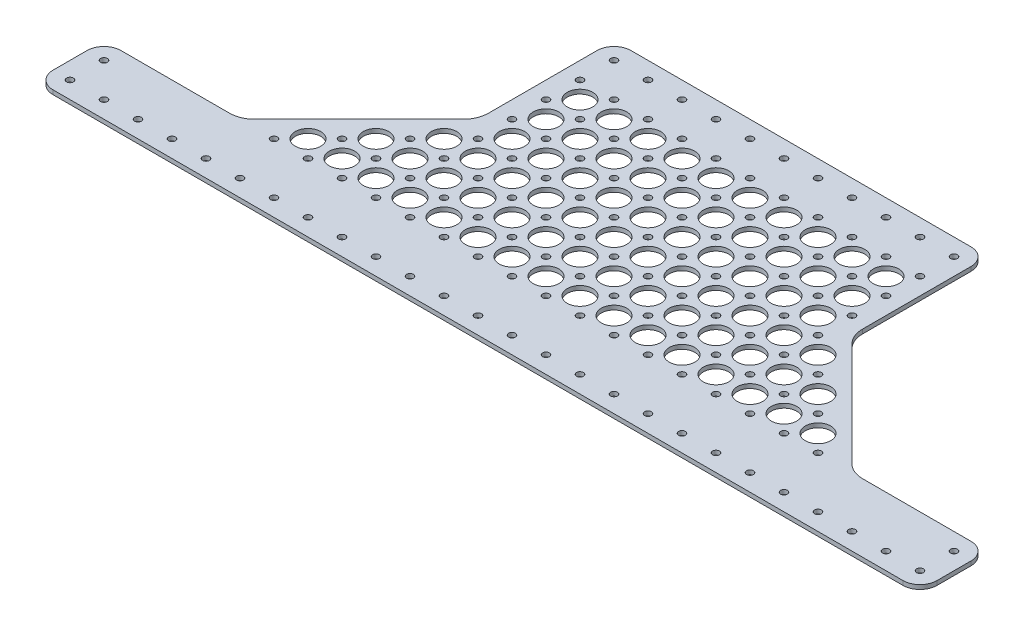
from build123d import *

# Parameters (mm, degrees)
SKETCH1_R           = 2.54
BOSS_EXTRUDE1_DEPTH = 3.175
SKETCH2_W           = 711.2
SKETCH2_H           = 25.4
CUT_EXTRUDE2_DEPTH  = 469.9
CUT_EXTRUDE3_START  = -3.175
SKETCH3_R           = 2.54
SKETCH3_R_2         = 9.525
CUT_EXTRUDE3_DEPTH  = 3.175
FILLET1_R           = 12.7
FILLET2_R           = 19.05


with BuildPart() as part:
    # Sketch1 → Boss-Extrude1 (new body)
    with BuildSketch(Plane(origin=(0, 0, 0), x_dir=(1, 0, 0), z_dir=(0, 1, 0))):
        Polygon((0, 101.6), (0, 0), (-88.904535599, -88.904535599), (-177.804535599, -88.904535599), (-190.504535599, -88.904535599), (-190.504535599, -419.104535599), (-177.804535599, -419.104535599), (-88.904535599, -419.104535599), (0, -508.009071197), (0, -609.609071197), (279.4, -609.609071197), (279.4, -508.009071197), (368.304535599, -419.104535599), (469.904535599, -419.104535599), (469.904535599, -88.904535599), (368.304535599, -88.904535599), (279.4, 0), (279.4, 101.6), align=None)
        with Locations((12.7, -596.909071197)):
            Circle(SKETCH1_R, mode=Mode.SUBTRACT)
        with Locations((38.1, -596.909071197)):
            Circle(SKETCH1_R, mode=Mode.SUBTRACT)
        with Locations((63.5, -596.909071197)):
            Circle(SKETCH1_R, mode=Mode.SUBTRACT)
        with Locations((88.9, -596.909071197)):
            Circle(SKETCH1_R, mode=Mode.SUBTRACT)
        with Locations((114.3, -596.909071197)):
            Circle(SKETCH1_R, mode=Mode.SUBTRACT)
        with Locations((139.7, -596.909071197)):
            Circle(SKETCH1_R, mode=Mode.SUBTRACT)
        with Locations((-177.804535599, -406.404535599)):
            Circle(SKETCH1_R, mode=Mode.SUBTRACT)
        with Locations((-152.404535599, -406.404535599)):
            Circle(SKETCH1_R, mode=Mode.SUBTRACT)
        with Locations((-127.004535599, -406.404535599)):
            Circle(SKETCH1_R, mode=Mode.SUBTRACT)
        with Locations((-177.804535599, -381.004535599)):
            Circle(SKETCH1_R, mode=Mode.SUBTRACT)
        with Locations((-152.404535599, -381.004535599)):
            Circle(SKETCH1_R, mode=Mode.SUBTRACT)
        with Locations((-177.804535599, -355.604535599)):
            Circle(SKETCH1_R, mode=Mode.SUBTRACT)
        with Locations((-127.004535599, -381.004535599)):
            Circle(SKETCH1_R, mode=Mode.SUBTRACT)
        with Locations((-101.604535599, -406.404535599)):
            Circle(SKETCH1_R, mode=Mode.SUBTRACT)
        with Locations((-101.604535599, -381.004535599)):
            Circle(SKETCH1_R, mode=Mode.SUBTRACT)
        with Locations((-177.804535599, -330.204535599)):
            Circle(SKETCH1_R, mode=Mode.SUBTRACT)
        with Locations((-177.804535599, -304.804535599)):
            Circle(SKETCH1_R, mode=Mode.SUBTRACT)
        with Locations((-177.804535599, -279.404535599)):
            Circle(SKETCH1_R, mode=Mode.SUBTRACT)
        with Locations((165.1, -596.909071197)):
            Circle(SKETCH1_R, mode=Mode.SUBTRACT)
        with Locations((190.5, -596.909071197)):
            Circle(SKETCH1_R, mode=Mode.SUBTRACT)
        with Locations((215.9, -596.909071197)):
            Circle(SKETCH1_R, mode=Mode.SUBTRACT)
        with Locations((241.3, -596.909071197)):
            Circle(SKETCH1_R, mode=Mode.SUBTRACT)
        with Locations((266.7, -596.909071197)):
            Circle(SKETCH1_R, mode=Mode.SUBTRACT)
        with Locations((381.004535599, -406.404535599)):
            Circle(SKETCH1_R, mode=Mode.SUBTRACT)
        with Locations((381.004535599, -381.004535599)):
            Circle(SKETCH1_R, mode=Mode.SUBTRACT)
        with Locations((406.404535599, -406.404535599)):
            Circle(SKETCH1_R, mode=Mode.SUBTRACT)
        with Locations((431.804535599, -406.404535599)):
            Circle(SKETCH1_R, mode=Mode.SUBTRACT)
        with Locations((457.204535599, -406.404535599)):
            Circle(SKETCH1_R, mode=Mode.SUBTRACT)
        with Locations((406.404535599, -381.004535599)):
            Circle(SKETCH1_R, mode=Mode.SUBTRACT)
        with Locations((431.804535599, -381.004535599)):
            Circle(SKETCH1_R, mode=Mode.SUBTRACT)
        with Locations((457.204535599, -381.004535599)):
            Circle(SKETCH1_R, mode=Mode.SUBTRACT)
        with Locations((457.204535599, -355.604535599)):
            Circle(SKETCH1_R, mode=Mode.SUBTRACT)
        with Locations((457.204535599, -330.204535599)):
            Circle(SKETCH1_R, mode=Mode.SUBTRACT)
        with Locations((457.204535599, -304.804535599)):
            Circle(SKETCH1_R, mode=Mode.SUBTRACT)
        with Locations((457.204535599, -279.404535599)):
            Circle(SKETCH1_R, mode=Mode.SUBTRACT)
        with Locations((-177.804535599, -254.004535599)):
            Circle(SKETCH1_R, mode=Mode.SUBTRACT)
        with Locations((-177.804535599, -228.604535599)):
            Circle(SKETCH1_R, mode=Mode.SUBTRACT)
        with Locations((-177.804535599, -203.204535599)):
            Circle(SKETCH1_R, mode=Mode.SUBTRACT)
        with Locations((-177.804535599, -177.804535599)):
            Circle(SKETCH1_R, mode=Mode.SUBTRACT)
        with Locations((-177.804535599, -152.404535599)):
            Circle(SKETCH1_R, mode=Mode.SUBTRACT)
        with Locations((-152.404535599, -152.404535599)):
            Circle(SKETCH1_R, mode=Mode.SUBTRACT)
        with Locations((-177.804535599, -127.004535599)):
            Circle(SKETCH1_R, mode=Mode.SUBTRACT)
        with Locations((-152.404535599, -127.004535599)):
            Circle(SKETCH1_R, mode=Mode.SUBTRACT)
        with Locations((-127.004535599, -152.404535599)):
            Circle(SKETCH1_R, mode=Mode.SUBTRACT)
        with Locations((-127.004535599, -127.004535599)):
            Circle(SKETCH1_R, mode=Mode.SUBTRACT)
        with Locations((-177.804535599, -101.604535599)):
            Circle(SKETCH1_R, mode=Mode.SUBTRACT)
        with Locations((-101.604535599, -152.404535599)):
            Circle(SKETCH1_R, mode=Mode.SUBTRACT)
        with Locations((-76.204535599, -152.404535599)):
            Circle(SKETCH1_R, mode=Mode.SUBTRACT)
        with Locations((-101.604535599, -127.004535599)):
            Circle(SKETCH1_R, mode=Mode.SUBTRACT)
        with Locations((-76.204535599, -127.004535599)):
            Circle(SKETCH1_R, mode=Mode.SUBTRACT)
        with Locations((-50.804535599, -152.404535599)):
            Circle(SKETCH1_R, mode=Mode.SUBTRACT)
        with Locations((-25.404535599, -152.404535599)):
            Circle(SKETCH1_R, mode=Mode.SUBTRACT)
        with Locations((-50.804535599, -127.004535599)):
            Circle(SKETCH1_R, mode=Mode.SUBTRACT)
        with Locations((-25.404535599, -127.004535599)):
            Circle(SKETCH1_R, mode=Mode.SUBTRACT)
        with Locations((-0.004535599, -152.404535599)):
            Circle(SKETCH1_R, mode=Mode.SUBTRACT)
        with Locations((-0.004535599, -127.004535599)):
            Circle(SKETCH1_R, mode=Mode.SUBTRACT)
        with Locations((25.395464401, -152.404535599)):
            Circle(SKETCH1_R, mode=Mode.SUBTRACT)
        with Locations((50.795464401, -152.404535599)):
            Circle(SKETCH1_R, mode=Mode.SUBTRACT)
        with Locations((25.395464401, -127.004535599)):
            Circle(SKETCH1_R, mode=Mode.SUBTRACT)
        with Locations((50.795464401, -127.004535599)):
            Circle(SKETCH1_R, mode=Mode.SUBTRACT)
        with Locations((76.195464401, -152.404535599)):
            Circle(SKETCH1_R, mode=Mode.SUBTRACT)
        with Locations((76.195464401, -127.004535599)):
            Circle(SKETCH1_R, mode=Mode.SUBTRACT)
        with Locations((101.595464401, -152.404535599)):
            Circle(SKETCH1_R, mode=Mode.SUBTRACT)
        with Locations((126.995464401, -152.404535599)):
            Circle(SKETCH1_R, mode=Mode.SUBTRACT)
        with Locations((101.595464401, -127.004535599)):
            Circle(SKETCH1_R, mode=Mode.SUBTRACT)
        with Locations((126.995464401, -127.004535599)):
            Circle(SKETCH1_R, mode=Mode.SUBTRACT)
        with Locations((12.7, 88.9)):
            Circle(SKETCH1_R, mode=Mode.SUBTRACT)
        with Locations((38.1, 88.9)):
            Circle(SKETCH1_R, mode=Mode.SUBTRACT)
        with Locations((63.5, 88.9)):
            Circle(SKETCH1_R, mode=Mode.SUBTRACT)
        with Locations((88.9, 88.9)):
            Circle(SKETCH1_R, mode=Mode.SUBTRACT)
        with Locations((114.3, 88.9)):
            Circle(SKETCH1_R, mode=Mode.SUBTRACT)
        with Locations((139.7, 88.9)):
            Circle(SKETCH1_R, mode=Mode.SUBTRACT)
        with Locations((152.395464401, -152.404535599)):
            Circle(SKETCH1_R, mode=Mode.SUBTRACT)
        with Locations((177.795464401, -152.404535599)):
            Circle(SKETCH1_R, mode=Mode.SUBTRACT)
        with Locations((152.395464401, -127.004535599)):
            Circle(SKETCH1_R, mode=Mode.SUBTRACT)
        with Locations((177.795464401, -127.004535599)):
            Circle(SKETCH1_R, mode=Mode.SUBTRACT)
        with Locations((203.195464401, -152.404535599)):
            Circle(SKETCH1_R, mode=Mode.SUBTRACT)
        with Locations((203.195464401, -127.004535599)):
            Circle(SKETCH1_R, mode=Mode.SUBTRACT)
        with Locations((228.595464401, -152.404535599)):
            Circle(SKETCH1_R, mode=Mode.SUBTRACT)
        with Locations((253.995464401, -152.404535599)):
            Circle(SKETCH1_R, mode=Mode.SUBTRACT)
        with Locations((228.595464401, -127.004535599)):
            Circle(SKETCH1_R, mode=Mode.SUBTRACT)
        with Locations((253.995464401, -127.004535599)):
            Circle(SKETCH1_R, mode=Mode.SUBTRACT)
        with Locations((279.395464401, -152.404535599)):
            Circle(SKETCH1_R, mode=Mode.SUBTRACT)
        with Locations((304.795464401, -152.404535599)):
            Circle(SKETCH1_R, mode=Mode.SUBTRACT)
        with Locations((279.395464401, -127.004535599)):
            Circle(SKETCH1_R, mode=Mode.SUBTRACT)
        with Locations((304.795464401, -127.004535599)):
            Circle(SKETCH1_R, mode=Mode.SUBTRACT)
        with Locations((457.204535599, -254.004535599)):
            Circle(SKETCH1_R, mode=Mode.SUBTRACT)
        with Locations((457.204535599, -228.604535599)):
            Circle(SKETCH1_R, mode=Mode.SUBTRACT)
        with Locations((457.204535599, -203.204535599)):
            Circle(SKETCH1_R, mode=Mode.SUBTRACT)
        with Locations((457.204535599, -177.804535599)):
            Circle(SKETCH1_R, mode=Mode.SUBTRACT)
        with Locations((330.195464401, -152.404535599)):
            Circle(SKETCH1_R, mode=Mode.SUBTRACT)
        with Locations((330.195464401, -127.004535599)):
            Circle(SKETCH1_R, mode=Mode.SUBTRACT)
        with Locations((355.595464401, -152.404535599)):
            Circle(SKETCH1_R, mode=Mode.SUBTRACT)
        with Locations((380.995464401, -152.404535599)):
            Circle(SKETCH1_R, mode=Mode.SUBTRACT)
        with Locations((355.595464401, -127.004535599)):
            Circle(SKETCH1_R, mode=Mode.SUBTRACT)
        with Locations((380.995464401, -127.004535599)):
            Circle(SKETCH1_R, mode=Mode.SUBTRACT)
        with Locations((406.395464401, -152.404535599)):
            Circle(SKETCH1_R, mode=Mode.SUBTRACT)
        with Locations((406.395464401, -127.004535599)):
            Circle(SKETCH1_R, mode=Mode.SUBTRACT)
        with Locations((431.795464401, -152.404535599)):
            Circle(SKETCH1_R, mode=Mode.SUBTRACT)
        with Locations((457.204535599, -152.404535599)):
            Circle(SKETCH1_R, mode=Mode.SUBTRACT)
        with Locations((431.795464401, -127.004535599)):
            Circle(SKETCH1_R, mode=Mode.SUBTRACT)
        with Locations((457.204535599, -127.004535599)):
            Circle(SKETCH1_R, mode=Mode.SUBTRACT)
        with Locations((457.204535599, -101.604535599)):
            Circle(SKETCH1_R, mode=Mode.SUBTRACT)
        with Locations((165.1, 88.9)):
            Circle(SKETCH1_R, mode=Mode.SUBTRACT)
        with Locations((190.5, 88.9)):
            Circle(SKETCH1_R, mode=Mode.SUBTRACT)
        with Locations((215.9, 88.9)):
            Circle(SKETCH1_R, mode=Mode.SUBTRACT)
        with Locations((241.3, 88.9)):
            Circle(SKETCH1_R, mode=Mode.SUBTRACT)
        with Locations((266.7, 88.9)):
            Circle(SKETCH1_R, mode=Mode.SUBTRACT)
    extrude(amount=BOSS_EXTRUDE1_DEPTH)

    # Sketch2 → Cut-Extrude2 (cut)
    with BuildSketch(Plane.XY.offset(609.609071197)):
        with Locations((152.586714342, 0)):
            Rectangle(SKETCH2_W, SKETCH2_H)
    extrude(amount=-CUT_EXTRUDE2_DEPTH, mode=Mode.SUBTRACT)

    # Sketch3 → Cut-Extrude3 (cut)
    with BuildSketch(Plane(origin=(0, 3.175, 0), x_dir=(1, 0, 0), z_dir=(0, 1, 0)).offset(CUT_EXTRUDE3_START)):
        with Locations((12.7, 88.9)):
            Circle(SKETCH3_R)
        with Locations((38.1, 88.9)):
            Circle(SKETCH3_R)
        with Locations((63.5, 88.9)):
            Circle(SKETCH3_R)
        with Locations((88.9, 88.9)):
            Circle(SKETCH3_R)
        with Locations((114.3, 88.9)):
            Circle(SKETCH3_R)
        with Locations((139.7, 88.9)):
            Circle(SKETCH3_R)
        with Locations((165.1, 88.9)):
            Circle(SKETCH3_R)
        with Locations((190.5, 88.9)):
            Circle(SKETCH3_R)
        with Locations((215.9, 88.9)):
            Circle(SKETCH3_R)
        with Locations((241.3, 88.9)):
            Circle(SKETCH3_R)
        with Locations((266.7, 88.9)):
            Circle(SKETCH3_R)
        with Locations((12.7, 63.5)):
            Circle(SKETCH3_R)
        with Locations((38.1, 63.5)):
            Circle(SKETCH3_R)
        with Locations((63.5, 63.5)):
            Circle(SKETCH3_R)
        with Locations((88.9, 63.5)):
            Circle(SKETCH3_R)
        with Locations((114.3, 63.5)):
            Circle(SKETCH3_R)
        with Locations((139.7, 63.5)):
            Circle(SKETCH3_R)
        with Locations((165.1, 63.5)):
            Circle(SKETCH3_R)
        with Locations((190.5, 63.5)):
            Circle(SKETCH3_R)
        with Locations((215.9, 63.5)):
            Circle(SKETCH3_R)
        with Locations((241.3, 63.5)):
            Circle(SKETCH3_R)
        with Locations((266.7, 63.5)):
            Circle(SKETCH3_R)
        with Locations((12.7, 38.1)):
            Circle(SKETCH3_R)
        with Locations((38.1, 38.1)):
            Circle(SKETCH3_R)
        with Locations((63.5, 38.1)):
            Circle(SKETCH3_R)
        with Locations((88.9, 38.1)):
            Circle(SKETCH3_R)
        with Locations((114.3, 38.1)):
            Circle(SKETCH3_R)
        with Locations((139.7, 38.1)):
            Circle(SKETCH3_R)
        with Locations((165.1, 38.1)):
            Circle(SKETCH3_R)
        with Locations((190.5, 38.1)):
            Circle(SKETCH3_R)
        with Locations((215.9, 38.1)):
            Circle(SKETCH3_R)
        with Locations((241.3, 38.1)):
            Circle(SKETCH3_R)
        with Locations((266.7, 38.1)):
            Circle(SKETCH3_R)
        with Locations((12.7, 12.7)):
            Circle(SKETCH3_R)
        with Locations((38.1, 12.7)):
            Circle(SKETCH3_R)
        with Locations((63.5, 12.7)):
            Circle(SKETCH3_R)
        with Locations((88.9, 12.7)):
            Circle(SKETCH3_R)
        with Locations((114.3, 12.7)):
            Circle(SKETCH3_R)
        with Locations((139.7, 12.7)):
            Circle(SKETCH3_R)
        with Locations((165.1, 12.7)):
            Circle(SKETCH3_R)
        with Locations((190.5, 12.7)):
            Circle(SKETCH3_R)
        with Locations((215.9, 12.7)):
            Circle(SKETCH3_R)
        with Locations((241.3, 12.7)):
            Circle(SKETCH3_R)
        with Locations((266.7, 12.7)):
            Circle(SKETCH3_R)
        with Locations((12.7, -12.7)):
            Circle(SKETCH3_R)
        with Locations((38.1, -12.7)):
            Circle(SKETCH3_R)
        with Locations((63.5, -12.7)):
            Circle(SKETCH3_R)
        with Locations((88.9, -12.7)):
            Circle(SKETCH3_R)
        with Locations((114.3, -12.7)):
            Circle(SKETCH3_R)
        with Locations((139.7, -12.7)):
            Circle(SKETCH3_R)
        with Locations((165.1, -12.7)):
            Circle(SKETCH3_R)
        with Locations((190.5, -12.7)):
            Circle(SKETCH3_R)
        with Locations((215.9, -12.7)):
            Circle(SKETCH3_R)
        with Locations((241.3, -12.7)):
            Circle(SKETCH3_R)
        with Locations((266.7, -12.7)):
            Circle(SKETCH3_R)
        with Locations((12.7, -38.1)):
            Circle(SKETCH3_R)
        with Locations((38.1, -38.1)):
            Circle(SKETCH3_R)
        with Locations((63.5, -38.1)):
            Circle(SKETCH3_R)
        with Locations((88.9, -38.1)):
            Circle(SKETCH3_R)
        with Locations((114.3, -38.1)):
            Circle(SKETCH3_R)
        with Locations((139.7, -38.1)):
            Circle(SKETCH3_R)
        with Locations((165.1, -38.1)):
            Circle(SKETCH3_R)
        with Locations((190.5, -38.1)):
            Circle(SKETCH3_R)
        with Locations((215.9, -38.1)):
            Circle(SKETCH3_R)
        with Locations((241.3, -38.1)):
            Circle(SKETCH3_R)
        with Locations((266.7, -38.1)):
            Circle(SKETCH3_R)
        with Locations((12.7, -63.5)):
            Circle(SKETCH3_R)
        with Locations((38.1, -63.5)):
            Circle(SKETCH3_R)
        with Locations((63.5, -63.5)):
            Circle(SKETCH3_R)
        with Locations((88.9, -63.5)):
            Circle(SKETCH3_R)
        with Locations((114.3, -63.5)):
            Circle(SKETCH3_R)
        with Locations((139.7, -63.5)):
            Circle(SKETCH3_R)
        with Locations((165.1, -63.5)):
            Circle(SKETCH3_R)
        with Locations((190.5, -63.5)):
            Circle(SKETCH3_R)
        with Locations((215.9, -63.5)):
            Circle(SKETCH3_R)
        with Locations((241.3, -63.5)):
            Circle(SKETCH3_R)
        with Locations((266.7, -63.5)):
            Circle(SKETCH3_R)
        with Locations((12.7, -88.9)):
            Circle(SKETCH3_R)
        with Locations((38.1, -88.9)):
            Circle(SKETCH3_R)
        with Locations((63.5, -88.9)):
            Circle(SKETCH3_R)
        with Locations((88.9, -88.9)):
            Circle(SKETCH3_R)
        with Locations((114.3, -88.9)):
            Circle(SKETCH3_R)
        with Locations((139.7, -88.9)):
            Circle(SKETCH3_R)
        with Locations((165.1, -88.9)):
            Circle(SKETCH3_R)
        with Locations((190.5, -88.9)):
            Circle(SKETCH3_R)
        with Locations((215.9, -88.9)):
            Circle(SKETCH3_R)
        with Locations((241.3, -88.9)):
            Circle(SKETCH3_R)
        with Locations((266.7, -88.9)):
            Circle(SKETCH3_R)
        with Locations((-12.7, -88.9)):
            Circle(SKETCH3_R)
        with Locations((-38.1, -88.9)):
            Circle(SKETCH3_R)
        with Locations((-63.5, -88.9)):
            Circle(SKETCH3_R)
        with Locations((-12.7, -63.5)):
            Circle(SKETCH3_R)
        with Locations((-38.1, -63.5)):
            Circle(SKETCH3_R)
        with Locations((-12.7, -38.1)):
            Circle(SKETCH3_R)
        with Locations((292.1, -88.9)):
            Circle(SKETCH3_R)
        with Locations((317.5, -88.9)):
            Circle(SKETCH3_R)
        with Locations((342.9, -88.9)):
            Circle(SKETCH3_R)
        with Locations((292.1, -63.5)):
            Circle(SKETCH3_R)
        with Locations((317.5, -63.5)):
            Circle(SKETCH3_R)
        with Locations((292.1, -38.1)):
            Circle(SKETCH3_R)
        with Locations((25.4, 50.8)):
            Circle(SKETCH3_R_2)
        with Locations((50.8, 50.8)):
            Circle(SKETCH3_R_2)
        with Locations((76.2, 50.8)):
            Circle(SKETCH3_R_2)
        with Locations((101.6, 50.8)):
            Circle(SKETCH3_R_2)
        with Locations((127, 50.8)):
            Circle(SKETCH3_R_2)
        with Locations((152.4, 50.8)):
            Circle(SKETCH3_R_2)
        with Locations((177.8, 50.8)):
            Circle(SKETCH3_R_2)
        with Locations((203.2, 50.8)):
            Circle(SKETCH3_R_2)
        with Locations((228.6, 50.8)):
            Circle(SKETCH3_R_2)
        with Locations((254, 50.8)):
            Circle(SKETCH3_R_2)
        with Locations((50.8, 25.4)):
            Circle(SKETCH3_R_2)
        with Locations((76.2, 25.4)):
            Circle(SKETCH3_R_2)
        with Locations((101.6, 25.4)):
            Circle(SKETCH3_R_2)
        with Locations((127, 25.4)):
            Circle(SKETCH3_R_2)
        with Locations((152.4, 25.4)):
            Circle(SKETCH3_R_2)
        with Locations((177.8, 25.4)):
            Circle(SKETCH3_R_2)
        with Locations((203.2, 25.4)):
            Circle(SKETCH3_R_2)
        with Locations((228.6, 25.4)):
            Circle(SKETCH3_R_2)
        with Locations((254, 25.4)):
            Circle(SKETCH3_R_2)
        with Locations((50.8, 0)):
            Circle(SKETCH3_R_2)
        with Locations((76.2, 0)):
            Circle(SKETCH3_R_2)
        with Locations((101.6, 0)):
            Circle(SKETCH3_R_2)
        with Locations((127, 0)):
            Circle(SKETCH3_R_2)
        with Locations((152.4, 0)):
            Circle(SKETCH3_R_2)
        with Locations((177.8, 0)):
            Circle(SKETCH3_R_2)
        with Locations((203.2, 0)):
            Circle(SKETCH3_R_2)
        with Locations((228.6, 0)):
            Circle(SKETCH3_R_2)
        with Locations((254, 0)):
            Circle(SKETCH3_R_2)
        with Locations((50.8, -25.4)):
            Circle(SKETCH3_R_2)
        with Locations((76.2, -25.4)):
            Circle(SKETCH3_R_2)
        with Locations((101.6, -25.4)):
            Circle(SKETCH3_R_2)
        with Locations((127, -25.4)):
            Circle(SKETCH3_R_2)
        with Locations((152.4, -25.4)):
            Circle(SKETCH3_R_2)
        with Locations((177.8, -25.4)):
            Circle(SKETCH3_R_2)
        with Locations((203.2, -25.4)):
            Circle(SKETCH3_R_2)
        with Locations((228.6, -25.4)):
            Circle(SKETCH3_R_2)
        with Locations((254, -25.4)):
            Circle(SKETCH3_R_2)
        with Locations((279.4, -25.4)):
            Circle(SKETCH3_R_2)
        with Locations((50.8, -50.8)):
            Circle(SKETCH3_R_2)
        with Locations((76.2, -50.8)):
            Circle(SKETCH3_R_2)
        with Locations((101.6, -50.8)):
            Circle(SKETCH3_R_2)
        with Locations((127, -50.8)):
            Circle(SKETCH3_R_2)
        with Locations((152.4, -50.8)):
            Circle(SKETCH3_R_2)
        with Locations((177.8, -50.8)):
            Circle(SKETCH3_R_2)
        with Locations((203.2, -50.8)):
            Circle(SKETCH3_R_2)
        with Locations((228.6, -50.8)):
            Circle(SKETCH3_R_2)
        with Locations((254, -50.8)):
            Circle(SKETCH3_R_2)
        with Locations((279.4, -50.8)):
            Circle(SKETCH3_R_2)
        with Locations((304.8, -50.8)):
            Circle(SKETCH3_R_2)
        with Locations((50.8, -76.2)):
            Circle(SKETCH3_R_2)
        with Locations((76.2, -76.2)):
            Circle(SKETCH3_R_2)
        with Locations((101.6, -76.2)):
            Circle(SKETCH3_R_2)
        with Locations((127, -76.2)):
            Circle(SKETCH3_R_2)
        with Locations((152.4, -76.2)):
            Circle(SKETCH3_R_2)
        with Locations((177.8, -76.2)):
            Circle(SKETCH3_R_2)
        with Locations((203.2, -76.2)):
            Circle(SKETCH3_R_2)
        with Locations((228.6, -76.2)):
            Circle(SKETCH3_R_2)
        with Locations((254, -76.2)):
            Circle(SKETCH3_R_2)
        with Locations((279.4, -76.2)):
            Circle(SKETCH3_R_2)
        with Locations((304.8, -76.2)):
            Circle(SKETCH3_R_2)
        with Locations((330.2, -76.2)):
            Circle(SKETCH3_R_2)
        with Locations((25.4, 25.4)):
            Circle(SKETCH3_R_2)
        with Locations((25.4, 0)):
            Circle(SKETCH3_R_2)
        with Locations((25.4, -25.4)):
            Circle(SKETCH3_R_2)
        with Locations((25.4, -50.8)):
            Circle(SKETCH3_R_2)
        with Locations((25.4, -76.2)):
            Circle(SKETCH3_R_2)
        with Locations((0, -25.4)):
            Circle(SKETCH3_R_2)
        with Locations((0, -50.8)):
            Circle(SKETCH3_R_2)
        with Locations((0, -76.2)):
            Circle(SKETCH3_R_2)
        with Locations((-25.4, -50.8)):
            Circle(SKETCH3_R_2)
        with Locations((-25.4, -76.2)):
            Circle(SKETCH3_R_2)
        with Locations((-50.8, -76.2)):
            Circle(SKETCH3_R_2)
    extrude(amount=CUT_EXTRUDE3_DEPTH, mode=Mode.SUBTRACT)

    # Fillet1
    fillet1_edges = [part.edges().sort_by_distance(p)[0] for p in [
        (-190.504535599, 1.5875, 88.904535599),
        (-190.504535599, 1.5875, 139.709071197),
        (469.904535599, 1.5875, 88.904535599),
        (469.904535599, 1.5875, 139.709071197),
        (279.4, 1.5875, -101.6),
        (0, 1.5875, -101.6),
    ]]
    fillet(fillet1_edges, radius=FILLET1_R)

    # Fillet2
    fillet2_edges = [part.edges().sort_by_distance(p)[0] for p in [
        (368.304535599, 1.5875, 88.904535599),
        (279.4, 1.5875, 0),
        (-88.904535599, 1.5875, 88.904535599),
        (0, 1.5875, 0),
    ]]
    fillet(fillet2_edges, radius=FILLET2_R)


solid = part.part
